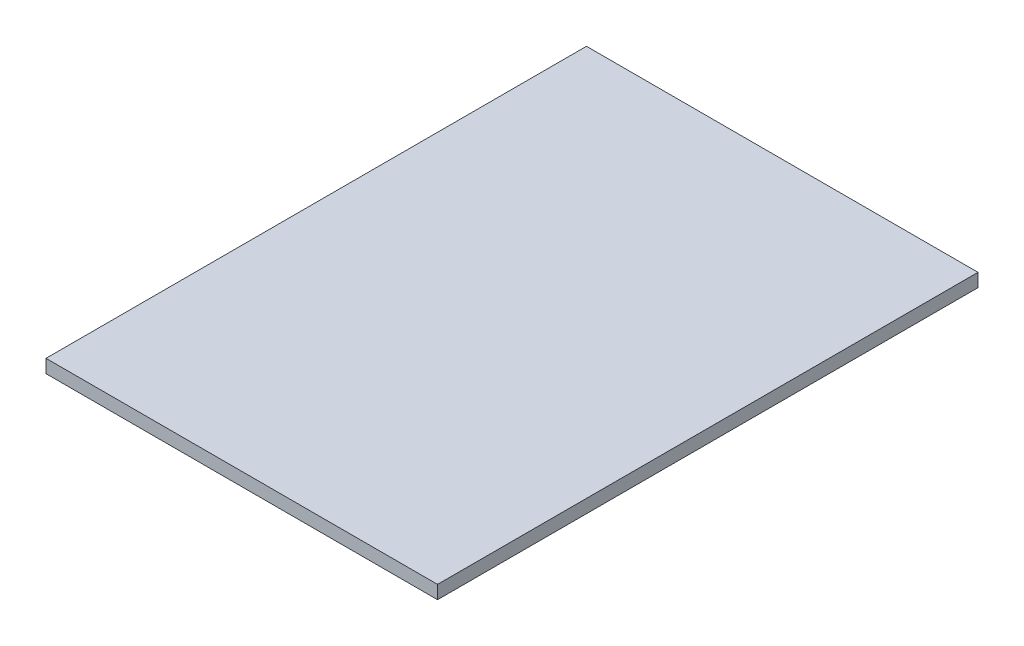
from build123d import *

# Parameters (mm, degrees)
SKETCH1_W           = 467.36
SKETCH1_H           = 645.16
BOSS_EXTRUDE1_DEPTH = 15.875


with BuildPart() as part:
    # Sketch1 → Boss-Extrude1 (new body)
    with BuildSketch(Plane(origin=(0, 0, 0), x_dir=(1, 0, 0), z_dir=(0, 1, 0))):
        with Locations((233.68, 322.58)):
            Rectangle(SKETCH1_W, SKETCH1_H)
    extrude(amount=BOSS_EXTRUDE1_DEPTH)


solid = part.part
